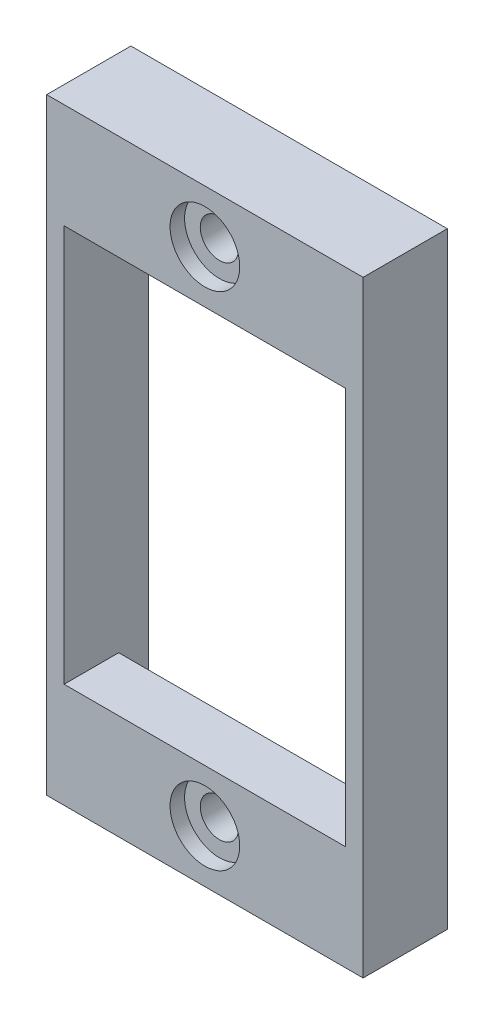
from build123d import *

# Parameters (mm, degrees)
BOSS_EXTRUDE1_DEPTH      = 0.25
BOSS_EXTRUDE1_DEPTH_BACK = 1.7
SKETCH1_W                = 27.24
SKETCH1_H                = 52.24
SKETCH1_W_2              = 24.24
SKETCH1_H_2              = 49.24
SKETCH2_W                = 27.24
SKETCH2_H                = 52.24
SKETCH2_W_2              = 24.24
SKETCH2_H_2              = 34.18
BOSS_EXTRUDE2_DEPTH      = 1
SKETCH3_W                = 3
SKETCH3_H                = 34.18
BOSS_EXTRUDE3_DEPTH      = 1
SKETCH4_W                = 6
SKETCH4_H                = 34.18
CUT_EXTRUDE1_DEPTH       = 2.95
SKETCH5_W                = 3
SKETCH5_H                = 0.2
BOSS_EXTRUDE4_DEPTH      = 0.5
BOSS_EXTRUDE5_DEPTH      = 0.6
FILLET1_R                = 1
SKETCH8_W                = 16.74
SKETCH8_H                = 34.18
BOSS_EXTRUDE6_DEPTH      = 3.7
SKETCH7_R                = 1.65
CUT_EXTRUDE2_DEPTH       = 4.7
SKETCH10_R               = 3
CUT_EXTRUDE3_DEPTH       = 1.25
SKETCH12_W               = 6.25
SKETCH12_H               = 34.18
SKETCH12_W_2             = 7.24
BOSS_EXTRUDE7_DEPTH      = 4.7
SKETCH18_W               = 7.24
SKETCH18_H               = 34.18
CUT_EXTRUDE6_DEPTH       = 4.7
SKETCH19_W               = 1.5
SKETCH19_H               = 7.25
BOSS_EXTRUDE8_DEPTH      = 34.18
SKETCH20_W               = 6.25
SKETCH20_H               = 34.18
CUT_EXTRUDE7_DEPTH       = 4.7


with BuildPart() as part:
    # Sketch1 → Boss-Extrude1 (new, two sides: drawn at the far end of the back side and taken through both)
    with BuildSketch(Plane.XY.offset(-BOSS_EXTRUDE1_DEPTH_BACK)):
        Rectangle(SKETCH1_W, SKETCH1_H)
        Rectangle(SKETCH1_W_2, SKETCH1_H_2, mode=Mode.SUBTRACT)
    extrude(amount=BOSS_EXTRUDE1_DEPTH + BOSS_EXTRUDE1_DEPTH_BACK)

    # Sketch2 → Boss-Extrude2 (add)
    with BuildSketch(Plane.XY.offset(0.25)):
        Rectangle(SKETCH2_W, SKETCH2_H)
        Rectangle(SKETCH2_W_2, SKETCH2_H_2, mode=Mode.SUBTRACT)
    extrude(amount=BOSS_EXTRUDE2_DEPTH)

    # Sketch3 → Boss-Extrude3 (add)
    with BuildSketch(Plane.XY.offset(1.25)):
        with Locations((-6.12, 0)):
            Rectangle(SKETCH3_W, SKETCH3_H)
    extrude(amount=-BOSS_EXTRUDE3_DEPTH)

    # Sketch4 → Cut-Extrude1 (cut)
    with BuildSketch(Plane.XY.offset(1.25)):
        with Locations((-10.62, 0)):
            Rectangle(SKETCH4_W, SKETCH4_H)
    extrude(amount=-CUT_EXTRUDE1_DEPTH, mode=Mode.SUBTRACT)

    # Sketch5 → Boss-Extrude4 (add)
    with BuildSketch(Plane.XZ.offset(-24.62)):
        with Locations((0, -1.6)):
            Rectangle(SKETCH5_W, SKETCH5_H)
    boss_extrude4 = extrude(amount=BOSS_EXTRUDE4_DEPTH)

    # Mirror1: Boss-Extrude4 across plane
    add(boss_extrude4.mirror(Plane.ZX))

    # Sketch6 → Boss-Extrude5 (add)
    with BuildSketch(Plane(origin=(0, 0, -1.7), x_dir=(-1, 0, 0), z_dir=(0, 0, -1))):
        Polygon((13.62, -26.12), (13.62, -17.09), (12.12, -17.09), (12.12, -24.62), (1.5, -24.62), (1.5, -24.12), (-1.5, -24.12), (-1.5, -24.62), (-12.12, -24.62), (-12.12, 24.62), (-1.5, 24.62), (-1.5, 24.12), (1.5, 24.12), (1.5, 24.62), (12.12, 24.62), (12.12, 17.09), (13.62, 17.09), (13.62, 26.12), (-13.62, 26.12), (-13.62, -26.12), align=None)
    extrude(amount=BOSS_EXTRUDE5_DEPTH)

    # Fillet1
    # the kernel refuses this fillet: 1 mm, written as the material it adds along each edge
    with BuildSketch(Plane(origin=(1.5, -24.62, -2.3), x_dir=(1, 0, 0), z_dir=(0, 0, 1)), Plane(origin=(-1.5, -24.62, -1.5), x_dir=(-1, 0, 0), z_dir=(0, 0, -1)), Plane(origin=(1.5, 24.62, -1.5), x_dir=(1, 0, 0), z_dir=(0, 0, -1)), Plane(origin=(-1.5, 24.62, -2.3), x_dir=(-1, 0, 0), z_dir=(0, 0, 1))) as fillet1_piece_1:
        with BuildLine():
            CenterArc((0.866025404, 1), FILLET1_R, 210, 60)
            Line((0, 0.5), (-0.017320508, 0.49))
            ThreePointArc((-0.017320508, 0.49), (-0.02, 0.25), (-0.02, 0))
            Line((-0.02, 0), (0, -0.02))
            Line((0, -0.02), (0.866025404, -0.02))
            Line((0.866025404, -0.02), (0.866025404, 0))
        make_face()
    extrude(amount=0.8)

    # Sketch8 → Boss-Extrude6 (add)
    with BuildSketch(Plane.XY.offset(1.25)):
        Polygon((-7.62, -17.09), (-13.62, -17.09), (-13.62, -26.12), (13.62, -26.12), (13.62, 26.12), (-13.62, 26.12), (-13.62, 17.09), (-7.62, 17.09), align=None)
        with Locations((3.75, 0)):
            Rectangle(SKETCH8_W, SKETCH8_H, mode=Mode.SUBTRACT)
    extrude(amount=BOSS_EXTRUDE6_DEPTH)

    # Sketch7 → Cut-Extrude2 (cut)
    with BuildSketch(Plane(origin=(0, 0, 0.25), x_dir=(-1, 0, 0), z_dir=(0, 0, -1))):
        with Locations((0, 21.59)):
            Circle(SKETCH7_R)
        with Locations((0, -21.59)):
            Circle(SKETCH7_R)
    extrude(amount=-CUT_EXTRUDE2_DEPTH, mode=Mode.SUBTRACT)

    # Sketch10 → Cut-Extrude3 (cut)
    with BuildSketch(Plane.XY.offset(4.95)):
        with Locations((0, 21.59)):
            Circle(SKETCH10_R)
        with Locations(Location((0, -21.59, 0), (0, 0, 180))):
            Circle(SKETCH10_R)
    extrude(amount=-CUT_EXTRUDE3_DEPTH, mode=Mode.SUBTRACT)

    # Sketch12 → Boss-Extrude7 (add)
    with BuildSketch(Plane(origin=(0, 0, 0.25), x_dir=(-1, 0, 0), z_dir=(0, 0, -1))):
        with Locations((-8.995, 0)):
            Rectangle(SKETCH12_W, SKETCH12_H)
        with Locations((6.25, 0)):
            Rectangle(SKETCH12_W_2, SKETCH12_H)
    extrude(amount=-BOSS_EXTRUDE7_DEPTH)

    # Sketch18 → Cut-Extrude6 (cut)
    with BuildSketch(Plane(origin=(0, 0, 0.25), x_dir=(-1, 0, 0), z_dir=(0, 0, -1))):
        with Locations((6.25, 0)):
            Rectangle(SKETCH18_W, SKETCH18_H)
    extrude(amount=-CUT_EXTRUDE6_DEPTH, mode=Mode.SUBTRACT)

    # Sketch19 → Boss-Extrude8 (add)
    with BuildSketch(Plane(origin=(0, -17.09, 0), x_dir=(1, 0, 0), z_dir=(0, 1, 0))):
        with Locations((-12.87, -1.325)):
            Rectangle(SKETCH19_W, SKETCH19_H)
    extrude(amount=BOSS_EXTRUDE8_DEPTH)

    # Sketch20 → Cut-Extrude7 (cut)
    with BuildSketch(Plane(origin=(0, 0, 0.25), x_dir=(-1, 0, 0), z_dir=(0, 0, -1))):
        with Locations((-8.995, 0)):
            Rectangle(SKETCH20_W, SKETCH20_H)
    extrude(amount=-CUT_EXTRUDE7_DEPTH, mode=Mode.SUBTRACT)


solid = part.part
